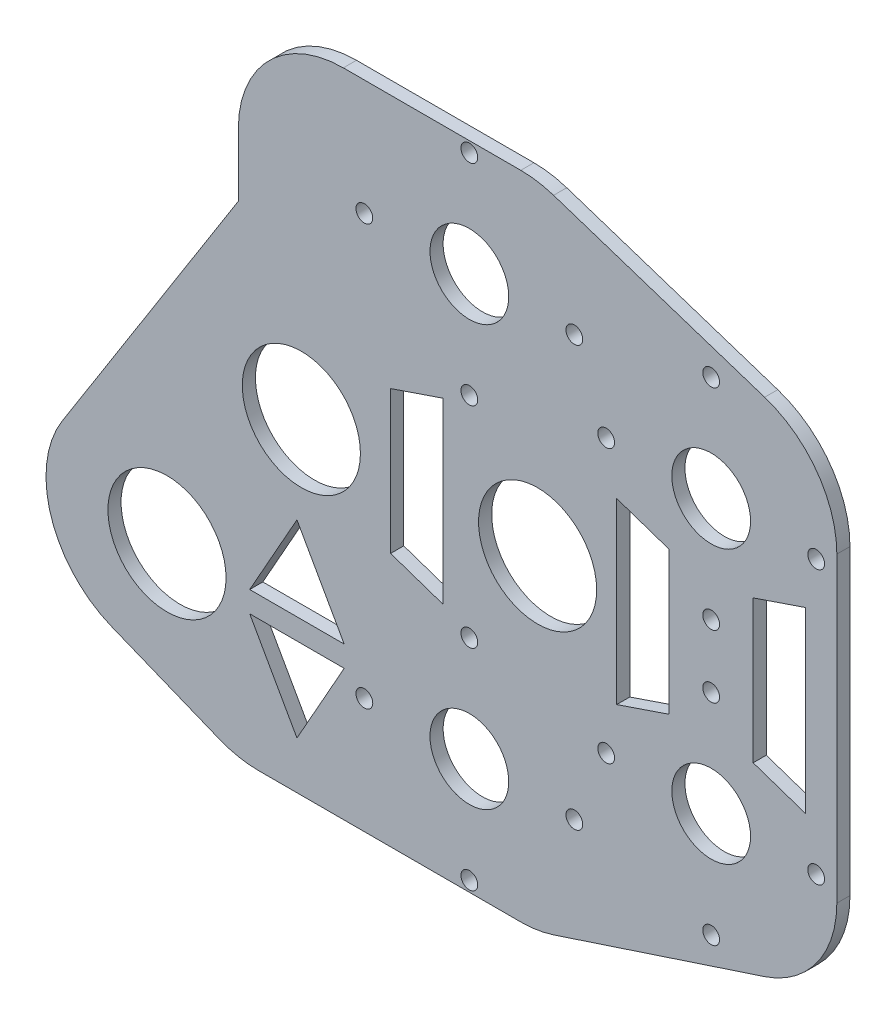
from build123d import *

# Parameters (mm, degrees)
SKETCH1_R           = 14.2875
SKETCH1_R_2         = 9.525
BASE_FLANGE1_DEPTH  = 3.175
SKETCH2_R           = 2.032
CUT_EXTRUDE1_DEPTH  = 3.175
BREAK_CORNER1_START = -3.175
BREAK_CORNER1_DEPTH = 3.175
CUT_EXTRUDE2_DEPTH  = 3.175


# Read off the part's stored shape, not the designer's step: Break-Corner1
# Sheet-metal steps are written as plain solids
with BuildPart() as part:
    # Sketch1 → Base-Flange1 (new body)
    with BuildSketch(Plane.XY):
        Polygon((-72.39, 38.1), (-72.39, 78.74), (0, 78.74), (72.39, 54.946557626), (72.39, -54.946557626), (0, -78.74), (-72.39, -78.74), (-131.261342758, -54.940525177), align=None)
        Circle(SKETCH1_R, mode=Mode.SUBTRACT)
        with Locations((-16.51, 50.800692145)):
            Circle(SKETCH1_R_2, mode=Mode.SUBTRACT)
        with Locations(Location((-16.51, -50.800692145, 0), (0, 0, 180))):
            Circle(SKETCH1_R_2, mode=Mode.SUBTRACT)
        with Locations((-57.15, 0)):
            Circle(SKETCH1_R, mode=Mode.SUBTRACT)
        with Locations((-89.654815243, -42.291755533)):
            Circle(SKETCH1_R, mode=Mode.SUBTRACT)
        with Locations((41.987736572, 33.02)):
            Circle(SKETCH1_R_2, mode=Mode.SUBTRACT)
        with Locations((41.987736572, -33.02)):
            Circle(SKETCH1_R_2, mode=Mode.SUBTRACT)
    extrude(amount=-BASE_FLANGE1_DEPTH)

    # Sketch2 → Cut-Extrude1 (cut)
    with BuildSketch(Plane.XY):
        with Locations((-16.51, 76.200692145)):
            Circle(SKETCH2_R)
        with Locations((8.89, 50.800692145)):
            Circle(SKETCH2_R)
        with Locations(Location((-16.51, 25.400692145, 0), (0, 0, 180))):
            Circle(SKETCH2_R)
        with Locations(Location((-41.91, 50.800692145, 0), (0, 0, 180))):
            Circle(SKETCH2_R)
        with Locations((-41.91, -50.800692145)):
            Circle(SKETCH2_R)
        with Locations(Location((-16.51, -76.200692145, 0), (0, 0, 180))):
            Circle(SKETCH2_R)
        with Locations(Location((8.89, -50.800692145, 0), (0, 0, 180))):
            Circle(SKETCH2_R)
        with Locations((-16.51, -25.400692145)):
            Circle(SKETCH2_R)
        with Locations((41.987736572, 58.42)):
            Circle(SKETCH2_R)
        with Locations(Location((41.987736572, 7.62, 0), (0, 0, 180))):
            Circle(SKETCH2_R)
        with Locations((16.587736572, 33.02)):
            Circle(SKETCH2_R)
        with Locations(Location((67.387736572, 33.02, 0), (0, 0, 180))):
            Circle(SKETCH2_R)
        with Locations((41.987736572, -7.62)):
            Circle(SKETCH2_R)
        with Locations((67.387736572, -33.02)):
            Circle(SKETCH2_R)
        with Locations(Location((41.987736572, -58.42, 0), (0, 0, 180))):
            Circle(SKETCH2_R)
        with Locations(Location((16.587736572, -33.02, 0), (0, 0, 180))):
            Circle(SKETCH2_R)
    extrude(amount=-CUT_EXTRUDE1_DEPTH, mode=Mode.SUBTRACT)

    # Break-Corner1 outline → Break-Corner1 (cut)
    with BuildSketch(Plane.XY.offset(BREAK_CORNER1_START)):
        with BuildLine():
            ThreePointArc((-72.39, 53.34), (-64.950512242, 71.300512242), (-46.99, 78.74))
            Line((-46.99, 78.74), (-72.39, 78.74))
            Line((-72.39, 78.74), (-72.39, 53.34))
        make_face()
        with BuildLine():
            Line((0, 78.74), (-4.067255107, 78.74))
            ThreePointArc((-4.067255107, 78.74), (-0.051162479, 78.420490426), (3.863892351, 77.47))
            Line((3.863892351, 77.47), (0, 78.74))
        make_face()
        with BuildLine():
            ThreePointArc((-103.041642579, -66.34869106), (-117.701544329, -50.578489915), (-114.985920109, -29.218776702))
            Line((-114.985920109, -29.218776702), (-131.261342758, -54.940525177))
            Line((-131.261342758, -54.940525177), (-103.041642579, -66.34869106))
        make_face()
        with BuildLine():
            Line((72.39, 54.946557626), (54.921147458, 60.688291792))
            ThreePointArc((54.921147458, 60.688291792), (67.564391187, 51.453070316), (72.39, 36.558291792))
            Line((72.39, 36.558291792), (72.39, 54.946557626))
        make_face()
        with BuildLine():
            ThreePointArc((-67.450063518, -78.74), (-72.299143718, -78.27283821), (-76.969853447, -76.888537103))
            Line((-76.969853447, -76.888537103), (-72.39, -78.74))
            Line((-72.39, -78.74), (-67.450063518, -78.74))
        make_face()
        with BuildLine():
            Line((72.39, -54.946557626), (72.39, -36.558291792))
            ThreePointArc((72.39, -36.558291792), (67.564391187, -51.453070316), (54.921147458, -60.688291792))
            Line((54.921147458, -60.688291792), (72.39, -54.946557626))
        make_face()
        with BuildLine():
            ThreePointArc((3.863892351, -77.47), (-0.051162479, -78.420490426), (-4.067255107, -78.74))
            Line((-4.067255107, -78.74), (0, -78.74))
            Line((0, -78.74), (3.863892351, -77.47))
        make_face()
    extrude(amount=BREAK_CORNER1_DEPTH, mode=Mode.SUBTRACT)

    # Sketch3 → Cut-Extrude2 (cut)
    with BuildSketch(Plane.XY):
        Polygon((64.847736572, 21.59), (64.847736572, -21.59), (52.147736572, -17.272), (52.147736572, 17.272), align=None)
        Polygon((19.127736572, 21.59), (19.127736572, -21.59), (31.827736572, -17.272), (31.827736572, 17.272), align=None)
        Polygon((-35.56, -17.272), (-22.86, -21.59), (-22.86, 21.59), (-35.56, 17.272), align=None)
        Polygon((-58.214986183, -67.274834659), (-69.644986183, -46.954834659), (-46.784986183, -46.954834659), align=None)
        Polygon((-69.644986183, -41.874834659), (-58.214986183, -21.554834659), (-46.784986183, -41.874834659), align=None)
    extrude(amount=-CUT_EXTRUDE2_DEPTH, mode=Mode.SUBTRACT)


solid = part.part
